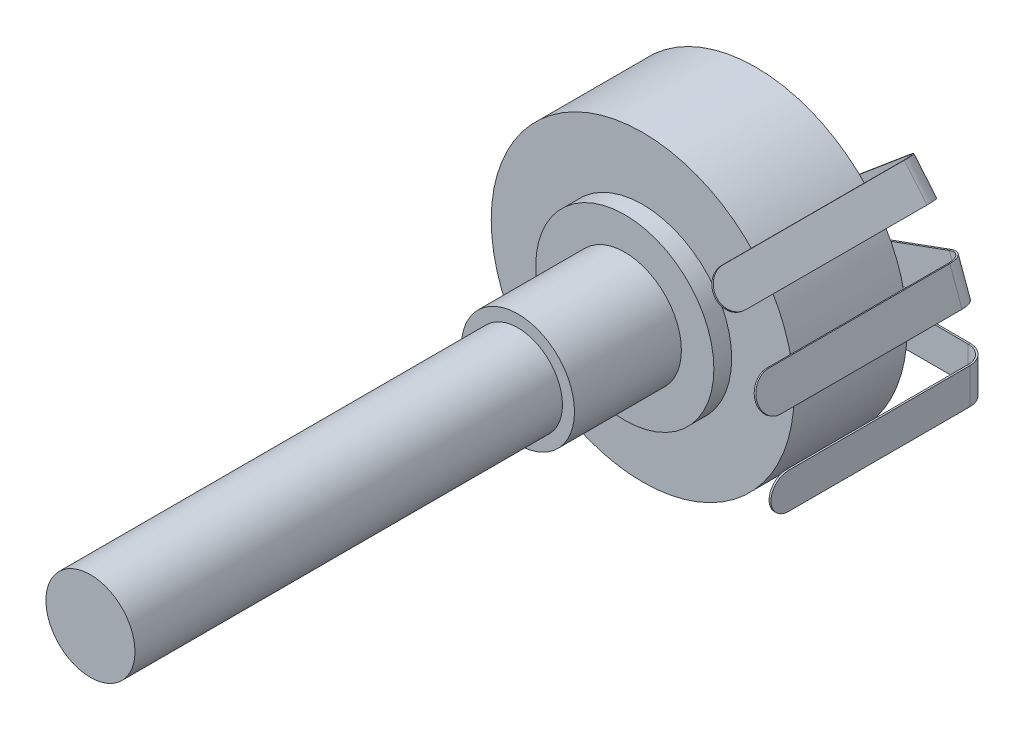
from build123d import *

# Parameters (mm, degrees)
SKETCH1_R                = 8.5
BOSS_EXTRUDE1_DEPTH      = 6.35
SKETCH2_R                = 5
BOSS_EXTRUDE2_DEPTH      = 1
SKETCH3_R                = 3.175
BOSS_EXTRUDE3_DEPTH      = 6
SKETCH4_R                = 2.5
BOSS_EXTRUDE4_DEPTH      = 24
BASE_FLANGE1_START       = -0.1
BASE_FLANGE1_DEPTH       = 0.1
SKETCHED_START           = 12.925331928
SKETCHED_BEND6_OUTLINE_W = 2
SKETCHED_BEND6_OUTLINE_H = 0.1
SKETCHED_BEND6_DEPTH     = 13.074668072
SKETCHED_START_2         = 11.925331928
SKETCHED_BEND6_2_DEPTH   = 1.1
SKETCHED_START_3         = -1
SKETCHED_BEND6_3_DEPTH   = 2
CIRPATTERN1_COUNT        = 3
CIRPATTERN1_ANGLE        = 40


with BuildPart() as part:
    # Sketch1 → Boss-Extrude1 (new body)
    with BuildSketch(Plane.XY):
        Circle(SKETCH1_R)
    extrude(amount=BOSS_EXTRUDE1_DEPTH)

    # Sketch2 → Boss-Extrude2 (add)
    with BuildSketch(Plane.XY.offset(6.35)):
        Circle(SKETCH2_R)
    extrude(amount=BOSS_EXTRUDE2_DEPTH)

    # Sketch3 → Boss-Extrude3 (add)
    with BuildSketch(Plane.XY.offset(7.35)):
        Circle(SKETCH3_R)
    extrude(amount=BOSS_EXTRUDE3_DEPTH)

    # Sketch4 → Boss-Extrude4 (add)
    with BuildSketch(Plane.XY.offset(13.35)):
        Circle(SKETCH4_R)
    extrude(amount=BOSS_EXTRUDE4_DEPTH)


with BuildPart() as body_2:
    # Base-Flange1: read off the stored shape, not the designer's step
    # Base-Flange1 outline → Base-Flange1 (new body)
    with BuildSketch(Plane.XY.offset(BASE_FLANGE1_START)):
        with BuildLine():
            Line((23.75, 1), (6.75, 1))
            ThreePointArc((6.75, 1), (5.75, 0), (6.75, -1))
            Line((6.75, -1), (23.75, -1))
            ThreePointArc((23.75, -1), (24.75, 0), (23.75, 1))
        make_face()
    extrude(amount=BASE_FLANGE1_DEPTH)

    # Sketched Bend6: read off the stored shape, not the designer's step
    # Sketched Bend6 outline → Sketched Bend6 (cut)
    with BuildSketch(Plane.YZ.offset(SKETCHED_START)):
        with Locations((0, -0.05)):
            Rectangle(SKETCHED_BEND6_OUTLINE_W, SKETCHED_BEND6_OUTLINE_H)
    extrude(amount=SKETCHED_BEND6_DEPTH, mode=Mode.SUBTRACT)

    # Sketched Bend6 2 outline → Sketched Bend6 2 (add)
    with BuildSketch(Plane.YZ.offset(SKETCHED_START_2)):
        with BuildLine():
            Line((1, 0), (1, 11.175331928))
            ThreePointArc((1, 11.175331928), (0, 12.175331928), (-1, 11.175331928))
            Line((-1, 11.175331928), (-1, 0))
            Line((-1, 0), (1, 0))
        make_face()
    extrude(amount=SKETCHED_BEND6_2_DEPTH)

    # Sketched Bend6 3 outline → Sketched Bend6 3 (cut)
    with BuildSketch(Plane(origin=(0, 0, 0), x_dir=(1, 0, 0), z_dir=(0, 1, 0)).offset(SKETCHED_START_3)):
        with BuildLine():
            Line((12.925331928, -14), (12.925331928, -1))
            ThreePointArc((12.925331928, -1), (12.63243871, -0.292893218), (11.925331928, 0))
            Line((11.925331928, 0), (11.925331928, -14))
            Line((11.925331928, -14), (12.925331928, -14))
        make_face()
        with BuildLine():
            Line((13.025331928, -1), (13.02533192, -14))
            Line((13.02533192, -14), (15, -14))
            Line((15, -14), (15, 0))
            Line((15, 0), (12.925331928, 0))
            Line((12.925331928, 0), (12.925331928, 0.1))
            Line((12.925331928, 0.1), (11.925331928, 0.1))
            ThreePointArc((11.925331928, 0.1), (12.703149387, -0.222182541), (13.025331928, -1))
        make_face()
    extrude(amount=SKETCHED_BEND6_3_DEPTH, mode=Mode.SUBTRACT)


with BuildPart() as cirpattern1_1:
    # CirPattern1: pattern copy
    add(body_2.part.rotate(Axis((0, 0, 0), (0, 0, 1)), 1 * CIRPATTERN1_ANGLE / (CIRPATTERN1_COUNT - 1)))


with BuildPart() as cirpattern1_2:
    # CirPattern1: pattern copy
    add(body_2.part.rotate(Axis((0, 0, 0), (0, 0, 1)), 2 * CIRPATTERN1_ANGLE / (CIRPATTERN1_COUNT - 1)))


solid = Compound([part.part, body_2.part, cirpattern1_1.part, cirpattern1_2.part])
